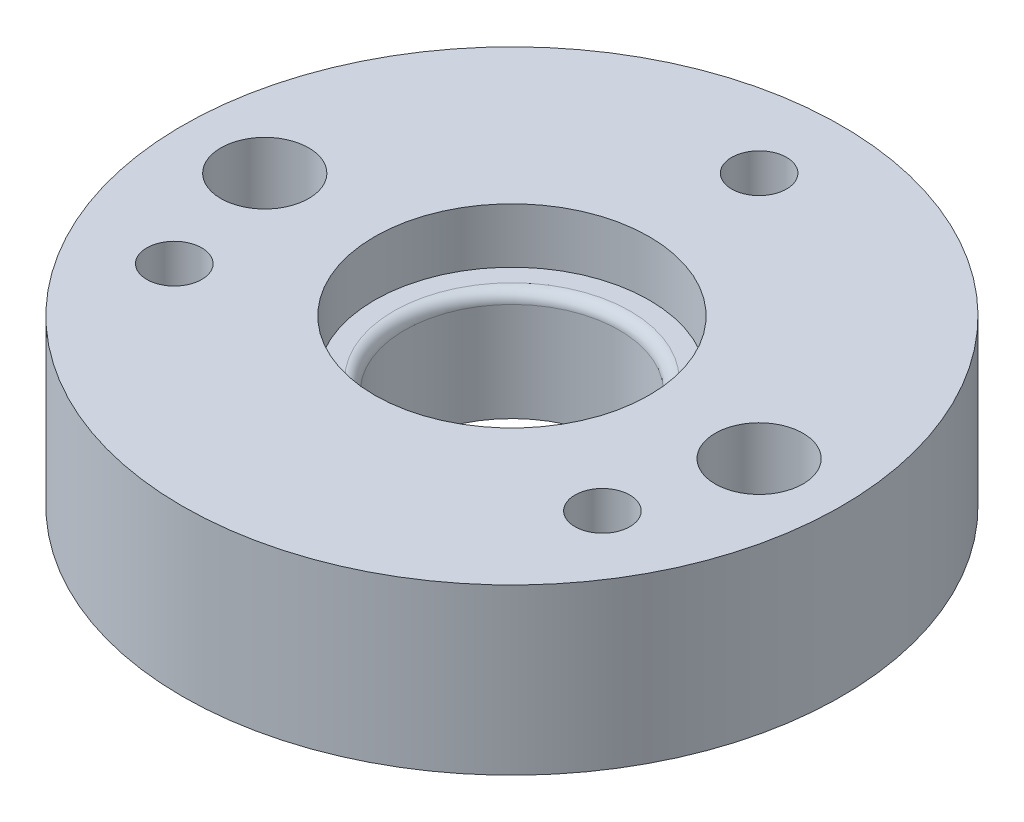
from build123d import *

# Parameters (mm, degrees)
SKETCH1_R             = 30
BOSS_EXTRUDE1_DEPTH   = 15
CUT_EXTRUDE1_REACH    = 47
SKETCH2_R             = 9.765
SKETCH3_R             = 12.5
CUT_EXTRUDE2_DEPTH    = 5
FILLET1_R             = 1
M6_TAPPED_HOLE1_D     = 5
M6_TAPPED_HOLE1_DEPTH = 17
M6_TAPPED_HOLE1_TIP   = 1.502151548
F_8_0MM_DOWEL_HOLE1_D = 8


with BuildPart() as part:
    # Sketch1 → Boss-Extrude1 (new body)
    with BuildSketch(Plane(origin=(0, 0, 0), x_dir=(1, 0, 0), z_dir=(0, 1, 0))):
        Circle(SKETCH1_R)
    extrude(amount=BOSS_EXTRUDE1_DEPTH)

    # Sketch2 → Cut-Extrude1 (cut, up to next)
    with BuildSketch(Plane(origin=(0, 15, 0), x_dir=(1, 0, 0), z_dir=(0, 1, 0)), mode=Mode.PRIVATE) as cut_extrude1_sk1:
        Circle(SKETCH2_R)
    cut_extrude1_tool1 = extrude(cut_extrude1_sk1.sketch, amount=-CUT_EXTRUDE1_REACH, mode=Mode.PRIVATE) & part.part
    add(cut_extrude1_tool1.solids().sort_by_distance((0, 15, 0))[0], mode=Mode.SUBTRACT)

    # Sketch3 → Cut-Extrude2 (cut)
    with BuildSketch(Plane(origin=(0, 15, 0), x_dir=(1, 0, 0), z_dir=(0, 1, 0))):
        Circle(SKETCH3_R)
    extrude(amount=-CUT_EXTRUDE2_DEPTH, mode=Mode.SUBTRACT)

    # Fillet1
    fillet1_edges = [part.edges().sort_by_distance(p)[0] for p in [
        (-9.765, 10, 0),
    ]]
    fillet(fillet1_edges, radius=FILLET1_R)

    # M6 Tapped Hole1
    with Locations(Plane(origin=(0, 15, 0), x_dir=(1, 0, 0), z_dir=(0, 1, 0))):
        with Locations((0, 22.5), (19.485571585, -11.25), (-19.485571585, -11.25)):
            Hole(M6_TAPPED_HOLE1_D / 2, depth=M6_TAPPED_HOLE1_DEPTH)
            with Locations((0, 0, -(M6_TAPPED_HOLE1_DEPTH + M6_TAPPED_HOLE1_TIP / 2))):  # 118° drill point
                Cone(0, M6_TAPPED_HOLE1_D / 2, M6_TAPPED_HOLE1_TIP, mode=Mode.SUBTRACT)

    # Ø8.0mm Dowel Hole1 (through all)
    with Locations(Plane(origin=(0, 15, 0), x_dir=(1, 0, 0), z_dir=(0, 1, 0))):
        with Locations((22.5, 0), (-22.5, 0)):
            Hole(F_8_0MM_DOWEL_HOLE1_D / 2)


solid = part.part
